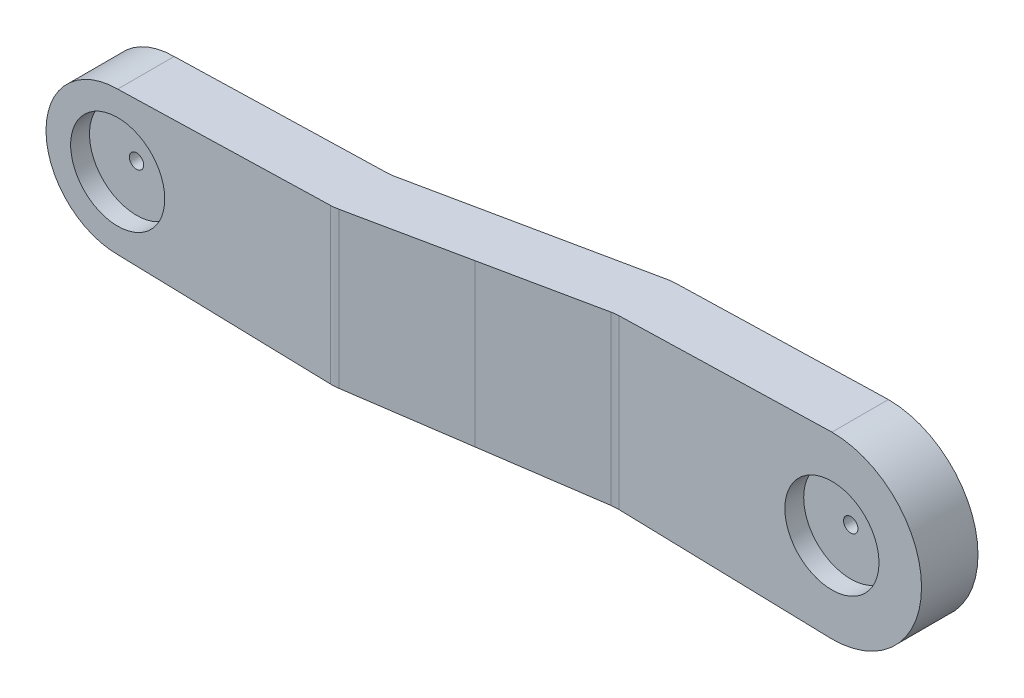
from build123d import *
from OCP.BRepFilletAPI import BRepFilletAPI_MakeChamfer

# Parameters (mm, degrees)
EXTRUDE_1_DEPTH     = 22
SKETCH_2_R          = 10.5
CUT_EXTRUDE_1_DEPTH = 4.2
CUT_EXTRUDE_START   = -9.4
CUT_EXTRUDE_6_DEPTH = 9.4
CUT_EXTRUDE_7_DEPTH = 9.4
SKETCH_4_R          = 10.5
CUT_EXTRUDE_2_DEPTH = 4.2
SKETCH_8_R          = 1.6
CUT_EXTRUDE_5_DEPTH = 173.095438638
CHAMFER_1_SIZE      = 4.7
CHAMFER_1_SIZE2     = 26.655024552
CHAMFER_2_SIZE2     = 26.655024552
CHAMFER_2_SIZE      = 4.7
CHAMFER_3_SIZE2     = 4.7
CHAMFER_3_SIZE      = 26.655024552
FILLET_4_R          = 10


with BuildPart() as part:
    # 草图1 → 凸台-拉伸1 (new body)
    with BuildSketch(Plane.XY):
        with BuildLine():
            Line((0, 16), (150, 20))
            ThreePointArc((150, 20), (170, 0), (150, -20))
            Line((150, -20), (0, -16))
            ThreePointArc((0, -16), (-16, 0), (0, 16))
        make_face()
    extrude(amount=EXTRUDE_1_DEPTH)

    # 草图2 → 切除-拉伸1 (cut)
    with BuildSketch(Plane.XY.offset(22)):
        Circle(SKETCH_2_R)
    extrude(amount=-CUT_EXTRUDE_1_DEPTH, mode=Mode.SUBTRACT)

    # 草图9 → 切除-拉伸6 (cut)
    with BuildSketch(Plane.XY.offset(22).offset(CUT_EXTRUDE_START)):
        with BuildLine():
            Line((75, 18), (75, -18))
            Line((75, -18), (150, -20))
            ThreePointArc((150, -20), (170, 0), (150, 20))
            Line((150, 20), (75, 18))
        make_face()
    extrude(amount=CUT_EXTRUDE_6_DEPTH, mode=Mode.SUBTRACT)

    # 草图10 → 切除-拉伸7 (cut)
    with BuildSketch(Plane(origin=(0, 0, 0), x_dir=(-1, 0, 0), z_dir=(0, 0, -1))):
        with BuildLine():
            Line((-75, 18), (-75, -18))
            Line((-75, -18), (0, -16))
            ThreePointArc((0, -16), (16, 0), (0, 16))
            Line((0, 16), (-75, 18))
        make_face()
    extrude(amount=-CUT_EXTRUDE_7_DEPTH, mode=Mode.SUBTRACT)

    # 草图4 → 切除-拉伸2 (cut)
    with BuildSketch(Plane(origin=(0, 0, 12.6), x_dir=(-1, 0, 0), z_dir=(0, 0, -1))):
        with Locations((-150, 0)):
            Circle(SKETCH_4_R)
    extrude(amount=CUT_EXTRUDE_2_DEPTH, mode=Mode.SUBTRACT)

    # 草图8 → 切除-拉伸5 (cut, through all)
    with BuildSketch(Plane.XY.offset(17.8)):
        Circle(SKETCH_8_R)
        with Locations((150, 0)):
            Circle(SKETCH_8_R)
    extrude(amount=-CUT_EXTRUDE_5_DEPTH, mode=Mode.SUBTRACT)

    # 倒角1: one chamfer whose edges measure the first distance from different faces: ONE call of the kernel's chamfer builder (chamfer() names one face for all edges)
    chamfer_1_edges_1 = [part.edges().sort_by_distance(p)[0] for p in [
        (75, 0, 12.6),
    ]]
    chamfer_1_side_1 = [part.faces().sort_by_distance(p)[0] for p in [
        (75, 0, 17.3),
    ]]
    chamfer_1_edges_2 = [part.edges().sort_by_distance(p)[0] for p in [
        (75, 0, 9.4),
    ]]
    chamfer_1_side_2 = [part.faces().sort_by_distance(p)[0] for p in [
        (75, 0, 4.7),
    ]]
    chamfer_1 = BRepFilletAPI_MakeChamfer(part.part.solid().wrapped)
    for e in chamfer_1_edges_1:
        chamfer_1.Add(CHAMFER_1_SIZE, CHAMFER_1_SIZE2, e.wrapped, chamfer_1_side_1[0].wrapped)  # the first distance lies on this face
    for e in chamfer_1_edges_2:
        chamfer_1.Add(CHAMFER_1_SIZE, CHAMFER_1_SIZE2, e.wrapped, chamfer_1_side_2[0].wrapped)  # the first distance lies on this face
    add(Compound.cast(chamfer_1.Shape()), mode=Mode.REPLACE)

    # 倒角2
    chamfer_2_edges = [part.edges().sort_by_distance(p)[0] for p in [
        (75, 0, 22),
    ]]
    chamfer_2_side = [part.faces().sort_by_distance(p)[0] for p in [
        (75, 0, 21.906),
    ]]
    chamfer(chamfer_2_edges, length=CHAMFER_2_SIZE - 0.0001, length2=CHAMFER_2_SIZE2 - 0.0001, reference=chamfer_2_side[0])  # a hair under: the kernel refuses the full size

    # 倒角3
    chamfer_3_edges = [part.edges().sort_by_distance(p)[0] for p in [
        (75, 0, 0),
    ]]
    chamfer_3_side = [part.faces().sort_by_distance(p)[0] for p in [
        (75.094, 0, 0),
    ]]
    chamfer(chamfer_3_edges, length=CHAMFER_3_SIZE - 0.0001, length2=CHAMFER_3_SIZE2 - 0.0001, reference=chamfer_3_side[0])  # a hair under: the kernel refuses the full size

    # 圆角4
    fillet_4_edges = [part.edges().sort_by_distance(p)[0] for p in [
        (101.655024552, 0, 12.6),
        (48.344975448, 0, 9.4),
        (48.345075448, 0, 22),
        (101.654924552, 0, 0),
    ]]
    fillet(fillet_4_edges, radius=FILLET_4_R)


solid = part.part
